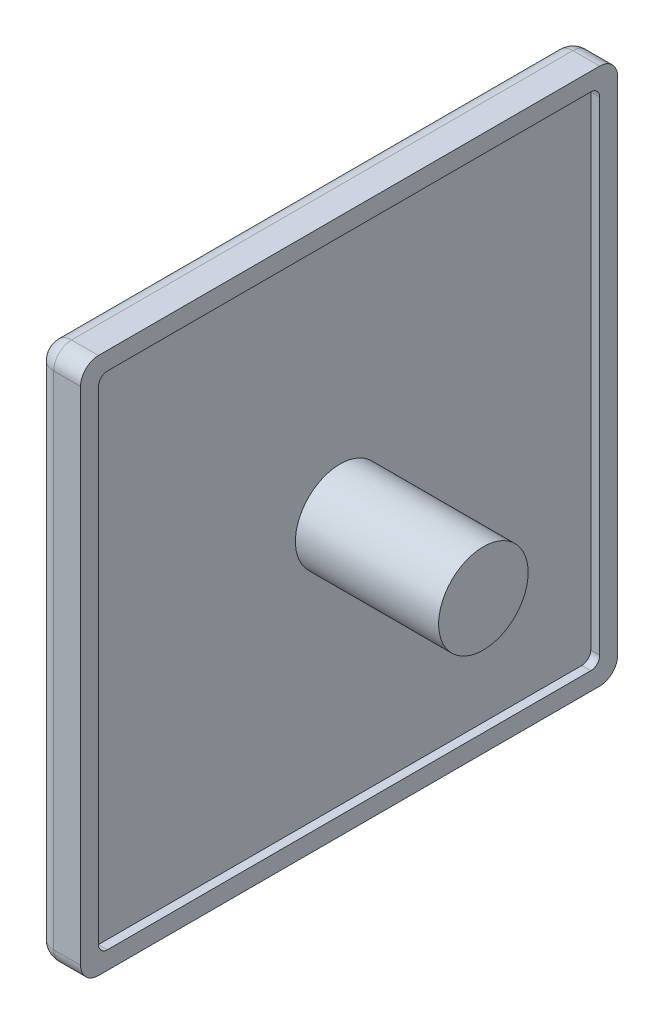
from build123d import *

# Parameters (mm, degrees)
SKETCH2_W           = 30
SKETCH2_H           = 30
BOSS_EXTRUDE1_DEPTH = 2.5
SKETCH3_W           = 28
SKETCH3_H           = 28
CUT_EXTRUDE1_DEPTH  = 0.5
FILLET1_R           = 1
FILLET2_R           = 1
FILLET3_R           = 0.5
SKETCH5_R           = 2.5
BOSS_EXTRUDE2_DEPTH = 8


with BuildPart() as part:
    # Sketch2 → Boss-Extrude1 (new body)
    with BuildSketch(Plane(origin=(0, 0, 0), x_dir=(0, 0, -1), z_dir=(1, 0, 0))):
        with Locations((15, 15)):
            Rectangle(SKETCH2_W, SKETCH2_H)
    extrude(amount=BOSS_EXTRUDE1_DEPTH)

    # Sketch3 → Cut-Extrude1 (cut)
    with BuildSketch(Plane(origin=(2.5, 0, 0), x_dir=(0, 0, -1), z_dir=(1, 0, 0))):
        with Locations((15, 15)):
            Rectangle(SKETCH3_W, SKETCH3_H)
    extrude(amount=-CUT_EXTRUDE1_DEPTH, mode=Mode.SUBTRACT)

    # Fillet1
    fillet1_edges = [part.edges().sort_by_distance(p)[0] for p in [
        (0, 30, -15),
        (0, 15, -30),
        (0, 0, -15),
        (0, 15, 0),
    ]]
    fillet(fillet1_edges, radius=FILLET1_R)

    # Fillet2
    # the kernel refuses this fillet: 1 mm, written as the material it takes off along each edge
    with BuildSketch(Plane(origin=(1, 29, -1), x_dir=(0, 1, 0), z_dir=(0, 0, 1))) as fillet2_piece_1_section:
        Polygon((0, 0), (FILLET2_R, 0), (FILLET2_R, FILLET2_R), (0, FILLET2_R), align=None)
    fillet2_piece_1 = extrude(amount=FILLET2_R, mode=Mode.PRIVATE)
    fillet2_piece_1 = fillet2_piece_1 - Plane(origin=(1, 29, -1), x_dir=(0.7071067811865475, -0.7071067811865475, 0), z_dir=(0, 0, 1)) * Sphere(FILLET2_R, mode=Mode.PRIVATE)
    add(fillet2_piece_1, mode=Mode.SUBTRACT)
    with BuildSketch(Plane(origin=(1, 29, -29), x_dir=(0, 1, 0), z_dir=(0, 0, -1))) as fillet2_piece_2_section:
        Polygon((0, 0), (FILLET2_R, 0), (FILLET2_R, -FILLET2_R), (0, -FILLET2_R), align=None)
    fillet2_piece_2 = extrude(amount=FILLET2_R, mode=Mode.PRIVATE)
    fillet2_piece_2 = fillet2_piece_2 - Plane(origin=(1, 29, -29), x_dir=(0.7071067811865475, -0.7071067811865475, 0), z_dir=(0, 0, -1)) * Sphere(FILLET2_R, mode=Mode.PRIVATE)
    add(fillet2_piece_2, mode=Mode.SUBTRACT)
    with BuildSketch(Plane(origin=(1, 1, -1), x_dir=(0, 0, 1), z_dir=(0, -1, 0))) as fillet2_piece_3_section:
        Polygon((0, 0), (FILLET2_R, 0), (FILLET2_R, FILLET2_R), (0, FILLET2_R), align=None)
    fillet2_piece_3 = extrude(amount=FILLET2_R, mode=Mode.PRIVATE)
    fillet2_piece_3 = fillet2_piece_3 - Plane(origin=(1, 1, -1), x_dir=(0.7071067811865475, 0, -0.7071067811865475), z_dir=(0, -1, 0)) * Sphere(FILLET2_R, mode=Mode.PRIVATE)
    add(fillet2_piece_3, mode=Mode.SUBTRACT)
    with BuildSketch(Plane(origin=(1, 1, -29), x_dir=(0, 0, -1), z_dir=(0, -1, 0))) as fillet2_piece_4_section:
        Polygon((0, 0), (FILLET2_R, 0), (FILLET2_R, -FILLET2_R), (0, -FILLET2_R), align=None)
    fillet2_piece_4 = extrude(amount=FILLET2_R, mode=Mode.PRIVATE)
    fillet2_piece_4 = fillet2_piece_4 - Plane(origin=(1, 1, -29), x_dir=(0.7071067811865475, 0, 0.7071067811865475), z_dir=(0, -1, 0)) * Sphere(FILLET2_R, mode=Mode.PRIVATE)
    add(fillet2_piece_4, mode=Mode.SUBTRACT)
    with BuildSketch(Plane(origin=(1, 30, 0), x_dir=(0, -1, 0), z_dir=(1, 0, 0)), Plane(origin=(1, 0, 0), x_dir=(0, 0, -1), z_dir=(1, 0, 0))) as fillet2_piece_5:
        with BuildLine():
            CenterArc((FILLET2_R, FILLET2_R), FILLET2_R, 180, 90)
            Line((0, FILLET2_R), (0, 0))
            Line((0, 0), (FILLET2_R, 0))
        make_face()
    extrude(amount=4, mode=Mode.SUBTRACT)
    with BuildSketch(Plane(origin=(1, 30, -30), x_dir=(0, -1, 0), z_dir=(1, 0, 0)), Plane(origin=(1, 0, -30), x_dir=(0, 0, 1), z_dir=(1, 0, 0))) as fillet2_piece_6:
        with BuildLine():
            CenterArc((FILLET2_R, -FILLET2_R), FILLET2_R, 90, 90)
            Line((0, -FILLET2_R), (0, 0))
            Line((0, 0), (FILLET2_R, 0))
        make_face()
    extrude(amount=4, mode=Mode.SUBTRACT)

    # Fillet3
    fillet3_edges = [part.edges().sort_by_distance(p)[0] for p in [
        (2.25, 1, -1),
        (2.25, 29, -1),
        (2.25, 29, -29),
        (2.25, 1, -29),
    ]]
    fillet(fillet3_edges, radius=FILLET3_R)

    # Sketch5 → Boss-Extrude2 (add)
    with BuildSketch(Plane(origin=(2, 0, 0), x_dir=(0, 0, -1), z_dir=(1, 0, 0))):
        with Locations((15, 15)):
            Circle(SKETCH5_R)
    extrude(amount=BOSS_EXTRUDE2_DEPTH)


solid = part.part
